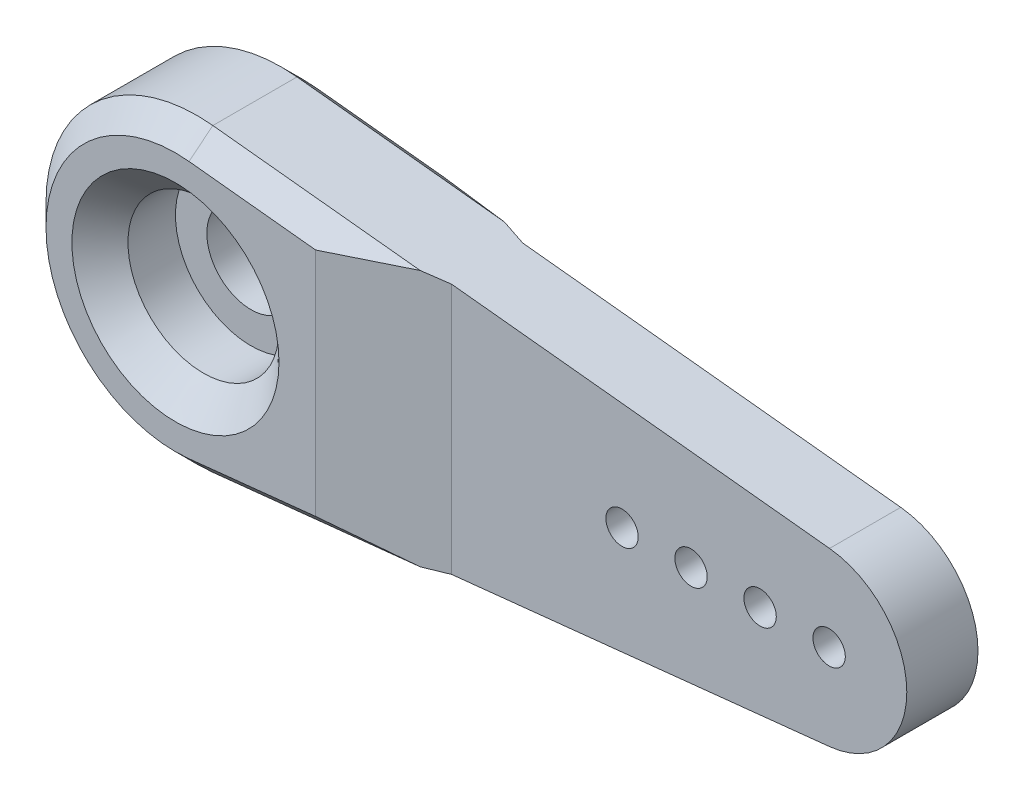
from build123d import *

# Parameters (mm, degrees)
ESQUISSE1_R             = 2.046773471
BOSS_EXTRU_1_DEPTH      = 3.3
BOSS_EXTRU_2_DEPTH      = 1.3
BOSS_EXTRU_2_DEPTH_BACK = 4.6
ESQUISSE2_R             = 2.046773471
CHANFREIN1_SIZE         = 5
CHANFREIN1_SIZE_2       = 1.3
CHANFREIN3_SIZE         = 5
CHANFREIN3_SIZE_2       = 1.3
CHANFREIN2_SIZE         = 1
ESQUISSE3_R             = 5.5
ESQUISSE3_R_2           = 2.75
BOSS_EXTRU_3_DEPTH      = 1.8
CHANFREIN4_SIZE         = 1.5
ESQUISSE4_R             = 3.5
ENL_V_MAT_EXTRU_1_DEPTH = 3.5
CHANFREIN5_SIZE         = 1.3
ESQUISSE5_R             = 0.75
ENL_V_MAT_EXTRU_2_DEPTH = 3.5


with BuildPart() as part:
    # Esquisse1 → Boss.-Extru.1 (new body)
    with BuildSketch(Plane.XY):
        with BuildLine():
            Line((0.734265734, 6.96138304), (29.01958042, 3.977933166))
            ThreePointArc((29.01958042, 3.977933166), (32.6, 0), (29.01958042, -3.977933166))
            Line((29.01958042, -3.977933166), (0.734265734, -6.96138304))
            ThreePointArc((0.734265734, -6.96138304), (-7, 0), (0.734265734, 6.96138304))
        make_face()
        Circle(ESQUISSE1_R, mode=Mode.SUBTRACT)
    extrude(amount=BOSS_EXTRU_1_DEPTH)

    # Esquisse2 → Boss.-Extru.2 (add, two sides: drawn at the far end of the back side and taken through both)
    with BuildSketch(Plane.XY.offset(3.3).offset(-BOSS_EXTRU_2_DEPTH_BACK)):
        with BuildLine():
            Line((0.734265734, 6.96138304), (6.5, 6.353230741))
            Line((6.5, 6.353230741), (6.5, -6.353230741))
            Line((6.5, -6.353230741), (0.734265734, -6.96138304))
            ThreePointArc((0.734265734, -6.96138304), (-7, 0), (0.734265734, 6.96138304))
        make_face()
        Circle(ESQUISSE2_R, mode=Mode.SUBTRACT)
    extrude(amount=BOSS_EXTRU_2_DEPTH + BOSS_EXTRU_2_DEPTH_BACK)

    # Chanfrein1
    # the kernel refuses this chamfer: 5, 1.3 mm, written as the material it adds along each edge
    with BuildSketch(Plane(origin=(6.5, 19.337751576, 3.3), x_dir=(0.9999530531472482, 0, -0.009689762716214913), z_dir=(0, -1, 0))) as chanfrein1_piece_1_section:
        Polygon((CHANFREIN1_SIZE * 0.999953053147, CHANFREIN1_SIZE * 0.00968976271621), (-CHANFREIN1_SIZE_2 * 0.00968976271621, CHANFREIN1_SIZE_2 * 0.999953053147), (0, 0), align=None)
    chanfrein1_piece_1 = extrude(amount=38.675503153, mode=Mode.PRIVATE)
    chanfrein1_piece_1 = split(chanfrein1_piece_1, bisect_by=Plane(origin=(8.862365218, 6.104055566, 3.683257133), z_dir=(-0.10489510489510492, -0.994483291447898, 0)), keep=Keep.TOP, mode=Mode.PRIVATE)
    chanfrein1_piece_1 = split(chanfrein1_piece_1, bisect_by=Plane(origin=(8.862365218, -6.104055566, 3.683257133), z_dir=(-0.10489510489510483, 0.9944832914478982, 0)), keep=Keep.TOP, mode=Mode.PRIVATE)
    chanfrein1_piece_1 = split(chanfrein1_piece_1, bisect_by=Plane(origin=(8.218527805, 0, 4.6), z_dir=(0, 0, -1)), keep=Keep.TOP, mode=Mode.PRIVATE)
    add(chanfrein1_piece_1)

    # Chanfrein3
    # the kernel refuses this chamfer: 5, 1.3 mm, written as the material it adds along each edge
    with BuildSketch(Plane(origin=(6.5, 19.337751576, 0), x_dir=(0.9999530531472482, 0, 0.009689762716214958), z_dir=(0, -1, 0))) as chanfrein3_piece_1_section:
        Polygon((CHANFREIN3_SIZE * 0.999953053147, -CHANFREIN3_SIZE * 0.00968976271621), (-CHANFREIN3_SIZE_2 * 0.00968976271621, -CHANFREIN3_SIZE_2 * 0.999953053147), (0, 0), align=None)
    chanfrein3_piece_1 = extrude(amount=38.675503153, mode=Mode.PRIVATE)
    chanfrein3_piece_1 = split(chanfrein3_piece_1, bisect_by=Plane(origin=(8.862365218, 6.104055566, -0.383257133), z_dir=(-0.10489510489499053, -0.9944832914479101, 0)), keep=Keep.TOP, mode=Mode.PRIVATE)
    chanfrein3_piece_1 = split(chanfrein3_piece_1, bisect_by=Plane(origin=(8.862365218, -6.104055566, -0.383257133), z_dir=(-0.10489510489499053, 0.9944832914479101, 0)), keep=Keep.TOP, mode=Mode.PRIVATE)
    chanfrein3_piece_1 = split(chanfrein3_piece_1, bisect_by=Plane(origin=(8.218527805, 0, -1.3), z_dir=(0, 0, 1)), keep=Keep.TOP, mode=Mode.PRIVATE)
    add(chanfrein3_piece_1)

    # Chanfrein2
    chanfrein2_edges = [part.edges().sort_by_distance(p)[0] for p in [
        (-7, 0, -1.3),
        (3.617132867, 6.65730689, -1.3),
        (3.617132867, -6.65730689, -1.3),
        (-7, 0, 4.6),
        (3.617132867, -6.65730689, 4.6),
        (3.617132867, 6.65730689, 4.6),
    ]]
    chamfer(chanfrein2_edges, length=CHANFREIN2_SIZE)

    # Esquisse3 → Boss.-Extru.3 (add)
    with BuildSketch(Plane(origin=(0, 0, -1.3), x_dir=(-1, 0, 0), z_dir=(0, 0, -1))):
        with Locations(Location((0, 0, 0), (0, 0, 180))):
            Circle(ESQUISSE3_R)
        Circle(ESQUISSE3_R_2, mode=Mode.SUBTRACT)
    extrude(amount=BOSS_EXTRU_3_DEPTH)

    # Chanfrein4
    chanfrein4_edges = [part.edges().sort_by_distance(p)[0] for p in [
        (-5.5, 0, -3.1),
    ]]
    chamfer(chanfrein4_edges, length=CHANFREIN4_SIZE)

    # Esquisse4 → Enlèv. mat.-Extru.1 (cut)
    with BuildSketch(Plane.XY.offset(4.6)):
        Circle(ESQUISSE4_R)
    extrude(amount=-ENL_V_MAT_EXTRU_1_DEPTH, mode=Mode.SUBTRACT)

    # Chanfrein5
    chanfrein5_edges = [part.edges().sort_by_distance(p)[0] for p in [
        (-3.5, 0, 4.6),
    ]]
    chamfer(chanfrein5_edges, length=CHANFREIN5_SIZE)

    # Esquisse5 → Enlèv. mat.-Extru.2 (cut)
    with BuildSketch(Plane.XY.offset(3.3)):
        with Locations((29, 0)):
            Circle(ESQUISSE5_R)
        with Locations((25.8, 0)):
            Circle(ESQUISSE5_R)
        with Locations((22.6, 0)):
            Circle(ESQUISSE5_R)
        with Locations((19.4, 0)):
            Circle(ESQUISSE5_R)
    extrude(amount=-ENL_V_MAT_EXTRU_2_DEPTH, mode=Mode.SUBTRACT)


solid = part.part
